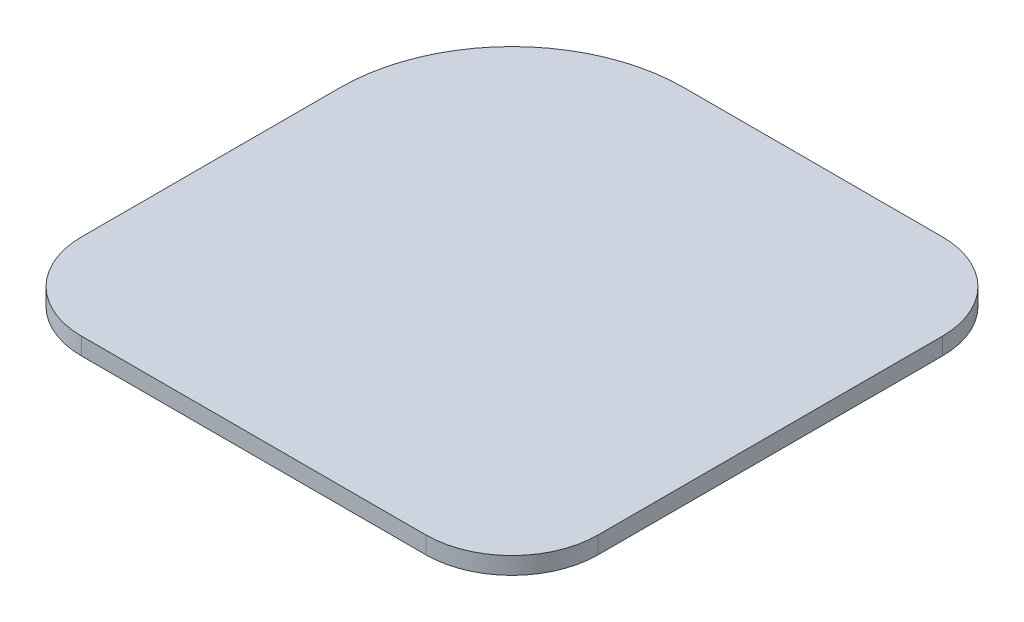
from build123d import *

# Parameters (mm, degrees)
BOSS_EXTRUDE1_DEPTH = 2
SCALE1_SCALE        = 0.9


with BuildPart() as part:
    # Sketch2 → Boss-Extrude1 (new body)
    with BuildSketch(Plane(origin=(0, 0, 0), x_dir=(1, 0, 0), z_dir=(0, 1, 0))):
        with BuildLine():
            Line((-10, 30), (20, 30))
            ThreePointArc((20, 30), (27.071067812, 27.071067812), (30, 20))
            Line((30, 20), (30, -20))
            ThreePointArc((30, -20), (27.071067812, -27.071067812), (20, -30))
            Line((20, -30), (-20, -30))
            ThreePointArc((-20, -30), (-27.071067812, -27.071067812), (-30, -20))
            Line((-30, -20), (-30, 10))
            ThreePointArc((-30, 10), (-24.142135624, 24.142135624), (-10, 30))
        make_face()
    extrude(amount=BOSS_EXTRUDE1_DEPTH)


with BuildPart() as part_1:
    # Scale1: scaled about (0.462600785, 1, 0.462600785)
    add(part.part.scale(SCALE1_SCALE).moved(Location((0.046260078, 0.1, 0.046260078))))


solid = part_1.part
